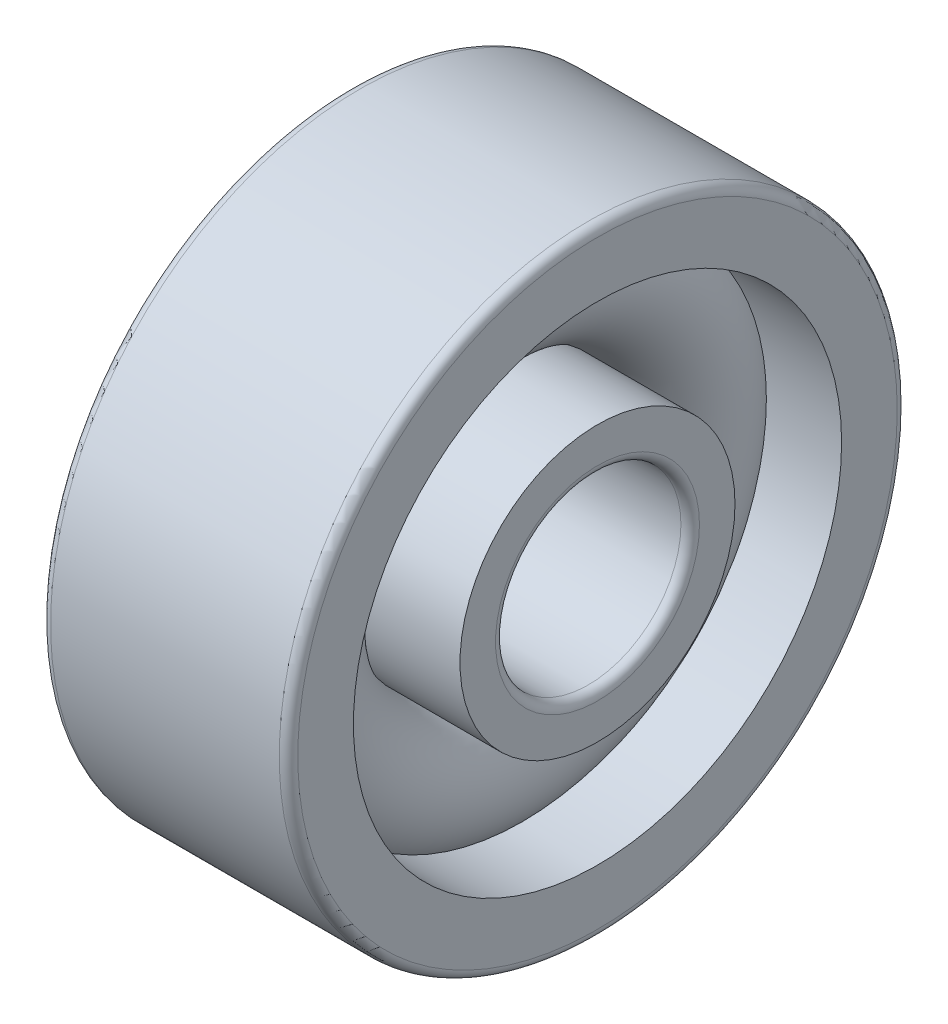
from build123d import *

# Parameters (mm, degrees)
CAGSPISKE_W     = 0.525
CAGSPISKE_H     = 0.35
CAGESPINE_ANGLE = 0.001
BALSIMSKE_R     = 1.05


with BuildPart() as part:
    # CagSpiSke → CageSpine (revolve)
    with BuildSketch(Plane.XY):
        with Locations((0, 3.25)):
            Rectangle(CAGSPISKE_W, CAGSPISKE_H)
    revolve(axis=Axis((-20.6375, 0, 0), (1, 0, 0)), revolution_arc=CAGESPINE_ANGLE)

    # BalSimSke → BallsSimplified (revolve)
    with BuildSketch(Plane.XY):
        with Locations((0, 3.25)):
            Circle(BALSIMSKE_R)
    revolve(axis=Axis((-10, 0, 0), (1, 0, 0)))

    # InnRacSke → InnerRace (revolve)
    with BuildSketch(Plane.XY):
        with BuildLine():
            Line((-0.748748957, 2.55), (-2, 2.55))
            Line((-2, 2.55), (-2, 1.65))
            ThreePointArc((-2, 1.65), (-1.956066017, 1.543933983), (-1.85, 1.5))
            Line((-1.85, 1.5), (1.85, 1.5))
            ThreePointArc((1.85, 1.5), (1.956066017, 1.543933983), (2, 1.65))
            Line((2, 1.65), (2, 2.225))
            Line((2, 2.225), (0, 2.225))
            ThreePointArc((0, 2.225), (-0.408120693, 2.309754022), (-0.748748957, 2.55))
        make_face()
    revolve(axis=Axis((-20.6375, 0, 0), (1, 0, 0)))

    # OutRacSke → OuterRace (revolve)
    with BuildSketch(Plane.XY):
        with BuildLine():
            Line((0, 4.275), (-2, 4.275))
            Line((-2, 4.275), (-2, 4.85))
            ThreePointArc((-2, 4.85), (-1.956066017, 4.956066017), (-1.85, 5))
            Line((-1.85, 5), (1.85, 5))
            ThreePointArc((1.85, 5), (1.956066017, 4.956066017), (2, 4.85))
            Line((2, 4.85), (2, 3.95))
            Line((2, 3.95), (0.748748957, 3.95))
            ThreePointArc((0.748748957, 3.95), (0.408120693, 4.190245978), (0, 4.275))
        make_face()
    revolve(axis=Axis((-20.6375, 0, 0), (1, 0, 0)))


solid = part.part
